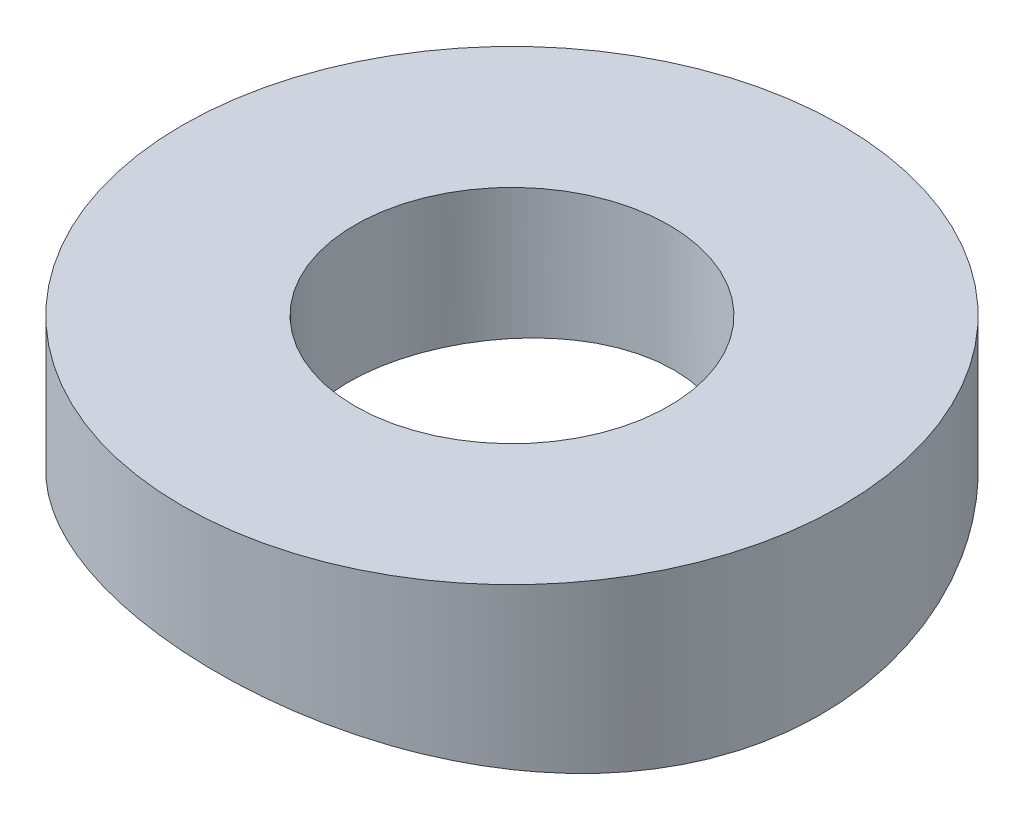
from build123d import *

# Parameters (mm, degrees)
SKETCH1_R                   = 5.25
SKETCH1_R_2                 = 2.5
BOSS_EXTRUDE1_DEPTH         = 0.5
BOSS_EXTRUDE2_START         = -1.450000367
BOSS_EXTRUDE2_OUTLINE_R     = 5.25
BOSS_EXTRUDE2_OUTLINE_R_2   = 2.5
BOSS_EXTRUDE2_DEPTH         = 1.450000367
BOSS_EXTRUDE2_START_2       = -2.256053573
BOSS_EXTRUDE2_2_OUTLINE_R   = 5.25
BOSS_EXTRUDE2_2_OUTLINE_R_2 = 2.5
BOSS_EXTRUDE2_2_DEPTH       = 0.806053206
BOSS_EXTRUDE2_START_3       = -6
BOSS_EXTRUDE2_3_DEPTH       = 12


with BuildPart() as part:
    # Sketch1 → Boss-Extrude1 (new body)
    with BuildSketch(Plane(origin=(0, 0, 0), x_dir=(1, 0, 0), z_dir=(0, 1, 0))):
        with Locations(Location((0, 0, 0), (0, 0, 270))):
            Circle(SKETCH1_R)
        with Locations(Location((0, 0, 0), (0, 0, 270))):
            Circle(SKETCH1_R_2, mode=Mode.SUBTRACT)
    extrude(amount=BOSS_EXTRUDE1_DEPTH)

    # Boss-Extrude2: read off the stored shape, not the designer's step
    # Boss-Extrude2 outline → Boss-Extrude2 (add)
    with BuildSketch(Plane(origin=(0, 0, 0), x_dir=(1, 0, 0), z_dir=(0, 1, 0)).offset(BOSS_EXTRUDE2_START)):
        Circle(BOSS_EXTRUDE2_OUTLINE_R)
        Circle(BOSS_EXTRUDE2_OUTLINE_R_2, mode=Mode.SUBTRACT)
    extrude(amount=BOSS_EXTRUDE2_DEPTH)

    # Boss-Extrude2 2 outline → Boss-Extrude2 2 (add)
    with BuildSketch(Plane(origin=(0, 0, 0), x_dir=(1, 0, 0), z_dir=(0, 1, 0)).offset(BOSS_EXTRUDE2_START_2)):
        Circle(BOSS_EXTRUDE2_2_OUTLINE_R)
        Circle(BOSS_EXTRUDE2_2_OUTLINE_R_2, mode=Mode.SUBTRACT)
    extrude(amount=BOSS_EXTRUDE2_2_DEPTH)

    # Boss-Extrude2 3 outline → Boss-Extrude2 3 (cut)
    with BuildSketch(Plane(origin=(0, 0, 0), x_dir=(0.9659258262890679, 0, 0.258819045102522), z_dir=(0.258819045102522, 0, -0.965925826289068)).offset(BOSS_EXTRUDE2_START_3)):
        with BuildLine():
            Line((5.249997023, 2.256063039), (-5.249997023, 2.256063039))
            ThreePointArc((-5.249997023, 2.256063039), (0, 1.45), (5.249997023, 2.256063039))
        make_face()
    extrude(amount=BOSS_EXTRUDE2_3_DEPTH, mode=Mode.SUBTRACT)


solid = part.part
